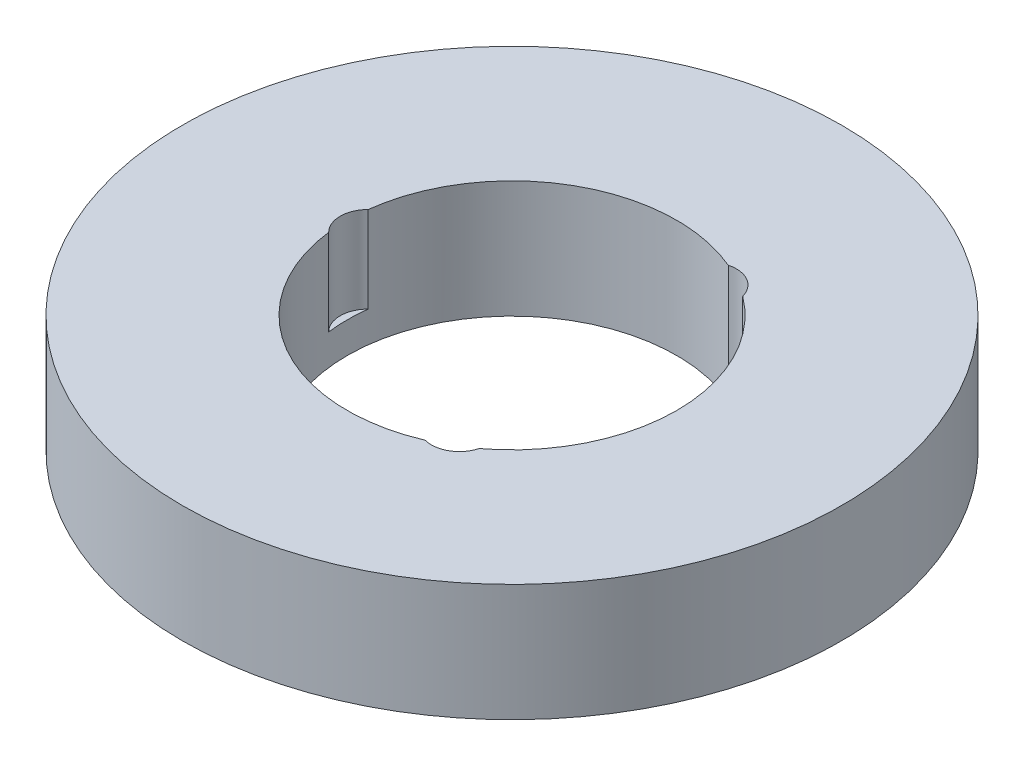
from build123d import *

# Parameters (mm, degrees)
SKETCH1_R           = 45
BOSS_EXTRUDE1_DEPTH = 16
SKETCH2_R           = 22.5
CUT_EXTRUDE1_DEPTH  = 66.620118866
SKETCH3_R           = 3.806036854
CUT_EXTRUDE2_DEPTH  = 11.774416519
CIRPATTERN1_COUNT   = 3


with BuildPart() as part:
    # Sketch1 → Boss-Extrude1 (new body)
    with BuildSketch(Plane(origin=(0, 0, 0), x_dir=(1, 0, 0), z_dir=(0, 1, 0))):
        Circle(SKETCH1_R)
    extrude(amount=BOSS_EXTRUDE1_DEPTH)

    # Sketch2 → Cut-Extrude1 (cut, through all)
    with BuildSketch(Plane(origin=(0, 0, 0), x_dir=(1, 0, 0), z_dir=(0, 1, 0))):
        Circle(SKETCH2_R)
    extrude(amount=CUT_EXTRUDE1_DEPTH, mode=Mode.SUBTRACT)

    # Sketch3 → Cut-Extrude2 (cut)
    with BuildSketch(Plane(origin=(0, 16, 0), x_dir=(1, 0, 0), z_dir=(0, 1, 0))):
        with Locations((-19.648909767, 0)):
            Circle(SKETCH3_R)
    cut_extrude2 = extrude(amount=-CUT_EXTRUDE2_DEPTH, mode=Mode.SUBTRACT)

    # CirPattern1: Cut-Extrude2 ×3 about axis
    cirpattern1_axis = Axis((0, 0, 0), (0, 1, 0))
    for i in range(1, CIRPATTERN1_COUNT):
        add(cut_extrude2.rotate(cirpattern1_axis, i * 360 / CIRPATTERN1_COUNT), mode=Mode.SUBTRACT)


solid = part.part
